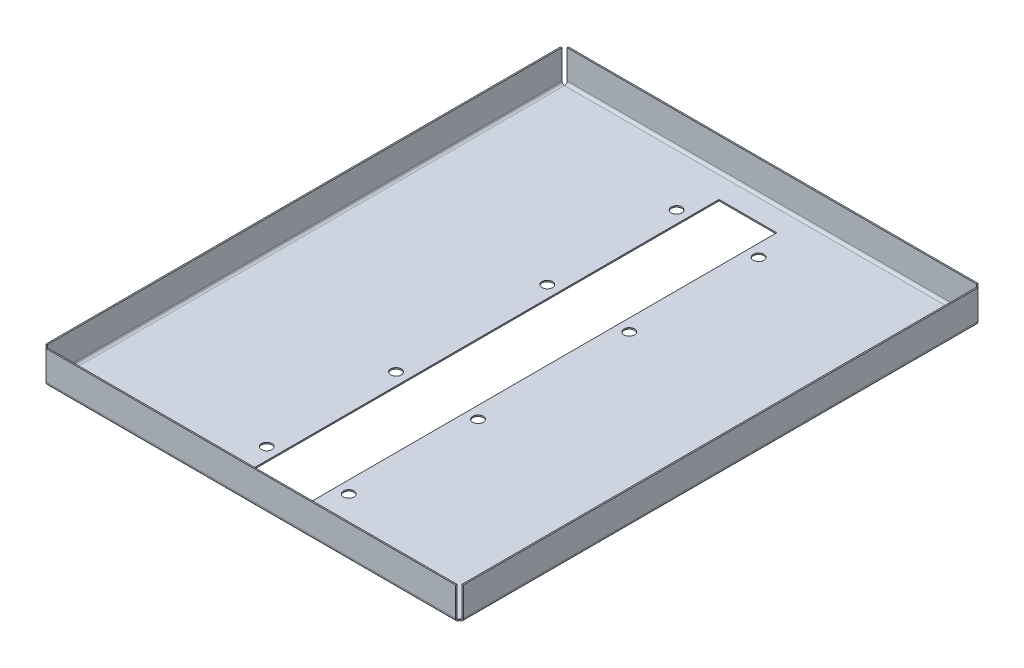
from build123d import *

# Parameters (mm, degrees)
SKETCH1_W          = 156
SKETCH1_H          = 196
BASE_FLANGE1_DEPTH = 0.5
EDGE_FLANGE1_DEPTH = 196
EDGE_FLANGE2_DEPTH = 156
EDGE_FLANGE3_DEPTH = 196
EDGE_FLANGE4_DEPTH = 156
SKETCH14_W         = 22
SKETCH14_H         = 180
CUT_EXTRUDE1_DEPTH = 2
SKETCH15_R         = 2
CUT_EXTRUDE2_DEPTH = 2


# Sheet-metal steps are written as plain solids
with BuildPart() as part:
    # Sketch1 → Base-Flange1 (new body)
    with BuildSketch(Plane(origin=(0, 0, 0), x_dir=(1, 0, 0), z_dir=(0, 1, 0))):
        with Locations((78, -98)):
            Rectangle(SKETCH1_W, SKETCH1_H)
    extrude(amount=-BASE_FLANGE1_DEPTH)

    # Edge-Flange1 section (across the edge) → Edge-Flange1 (add)
    with BuildSketch(Plane(origin=(-1, 0, 0), x_dir=(1, 0, 0), z_dir=(0, 0, 1))):
        with BuildLine():
            Line((-0.5, 1), (-0.5, 12))
            Line((-0.5, 12), (0, 12))
            Line((0, 12), (0, 1))
            ThreePointArc((0, 1), (0.292893219, 0.292893219), (1, 0))
            Line((1, 0), (1, -0.5))
            ThreePointArc((1, -0.5), (-0.060660172, -0.060660172), (-0.5, 1))
        make_face()
    extrude(amount=EDGE_FLANGE1_DEPTH)

    # Edge-Flange2 section (across the edge) → Edge-Flange2 (add)
    with BuildSketch(Plane(origin=(0, 0, 197), x_dir=(0, 0, -1), z_dir=(1, 0, 0))):
        with BuildLine():
            Line((-0.5, 1), (-0.5, 12))
            Line((-0.5, 12), (0, 12))
            Line((0, 12), (0, 1))
            ThreePointArc((0, 1), (0.292893219, 0.292893219), (1, 0))
            Line((1, 0), (1, -0.5))
            ThreePointArc((1, -0.5), (-0.060660172, -0.060660172), (-0.5, 1))
        make_face()
    extrude(amount=EDGE_FLANGE2_DEPTH)

    # Edge-Flange3 section (across the edge) → Edge-Flange3 (add)
    with BuildSketch(Plane(origin=(157, 0, 196), x_dir=(-1, 0, 0), z_dir=(0, 0, -1))):
        with BuildLine():
            Line((-0.5, 1), (-0.5, 12))
            Line((-0.5, 12), (0, 12))
            Line((0, 12), (0, 1))
            ThreePointArc((0, 1), (0.292893219, 0.292893219), (1, 0))
            Line((1, 0), (1, -0.5))
            ThreePointArc((1, -0.5), (-0.060660172, -0.060660172), (-0.5, 1))
        make_face()
    extrude(amount=EDGE_FLANGE3_DEPTH)

    # Edge-Flange4 section (across the edge) → Edge-Flange4 (add)
    with BuildSketch(Plane(origin=(156, 0, -1), x_dir=(0, 0, 1), z_dir=(-1, 0, 0))):
        with BuildLine():
            Line((-0.5, 1), (-0.5, 12))
            Line((-0.5, 12), (0, 12))
            Line((0, 12), (0, 1))
            ThreePointArc((0, 1), (0.292893219, 0.292893219), (1, 0))
            Line((1, 0), (1, -0.5))
            ThreePointArc((1, -0.5), (-0.060660172, -0.060660172), (-0.5, 1))
        make_face()
    extrude(amount=EDGE_FLANGE4_DEPTH)

    # Sketch14 → Cut-Extrude1 (cut)
    with BuildSketch(Plane.XZ.offset(0.5)):
        with Locations((78, 98.144635834)):
            Rectangle(SKETCH14_W, SKETCH14_H)
    extrude(amount=-CUT_EXTRUDE1_DEPTH, mode=Mode.SUBTRACT)

    # Sketch15 → Cut-Extrude2 (cut)
    with BuildSketch(Plane(origin=(0, 0, 0), x_dir=(1, 0, 0), z_dir=(0, 1, 0))):
        with Locations(Location((93.6217, -175.805181717, 0), (0, 0, 270))):
            Circle(SKETCH15_R)
        with Locations(Location((62.3851, -175.805181717, 0), (0, 0, 270))):
            Circle(SKETCH15_R)
        with Locations(Location((93.6217, -126.552336837, 0), (0, 0, 270))):
            Circle(SKETCH15_R)
        with Locations(Location((62.3851, -126.552336837, 0), (0, 0, 270))):
            Circle(SKETCH15_R)
        with Locations(Location((93.6217, -68.939033602, 0), (0, 0, 270))):
            Circle(SKETCH15_R)
        with Locations(Location((62.3851, -68.939033602, 0), (0, 0, 270))):
            Circle(SKETCH15_R)
        with Locations(Location((93.6217, -19.686188722, 0), (0, 0, 270))):
            Circle(SKETCH15_R)
        with Locations(Location((62.3851, -19.686188722, 0), (0, 0, 270))):
            Circle(SKETCH15_R)
    extrude(amount=-CUT_EXTRUDE2_DEPTH, mode=Mode.SUBTRACT)


solid = part.part
